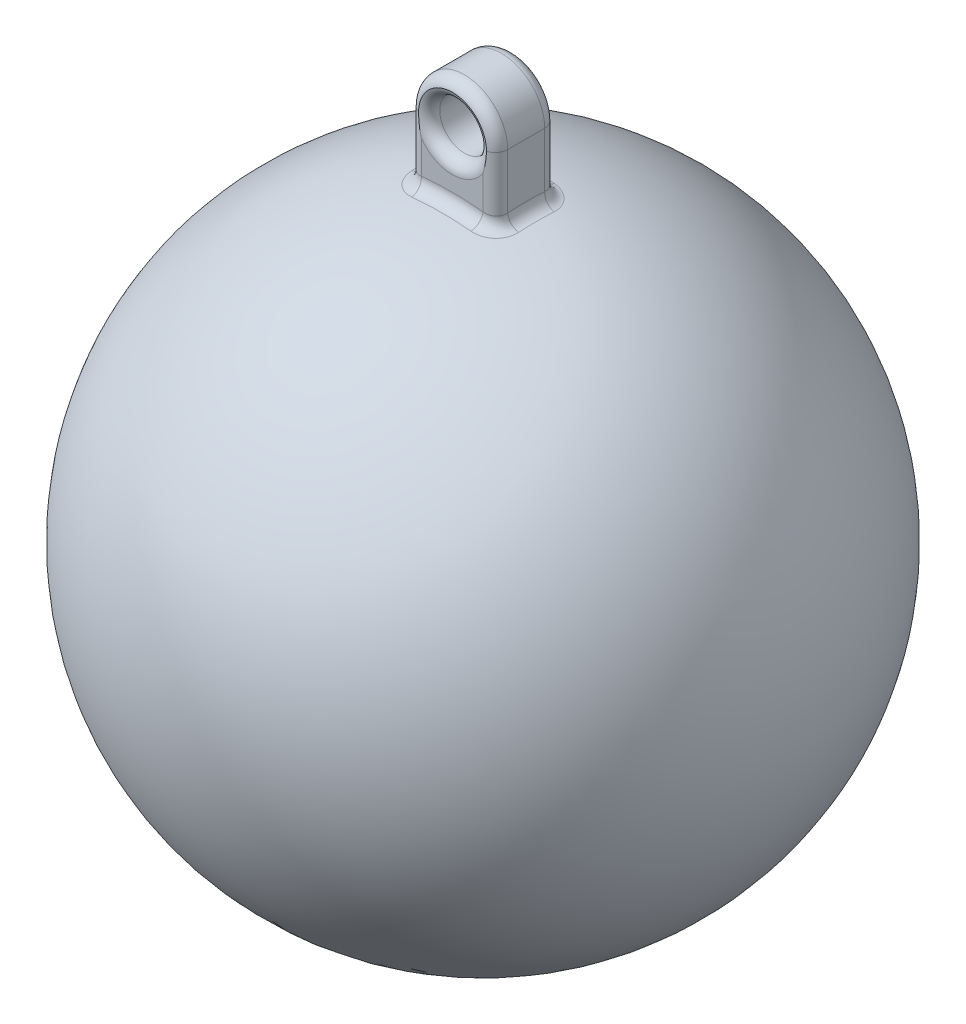
from build123d import *

# Parameters (mm, degrees)
SKETCH2_R           = 2
BOSS_EXTRUDE1_DEPTH = 2.5
FILLET1_R           = 1


with BuildPart() as part:
    # Sketch1 → Revolve1 (revolve)
    with BuildSketch(Plane(origin=(0, 0, 0), x_dir=(1, 0, 0), z_dir=(0, 1, 0))):
        with BuildLine():
            Line((-25, 0), (25, 0))
            ThreePointArc((25, 0), (0, 25), (-25, 0))
        make_face()
    revolve(axis=Axis((-25, 0, 0), (1, 0, 0)))

    # Sketch2 → Boss-Extrude1 (add, symmetric)
    with BuildSketch(Plane.XY):
        with BuildLine():
            Line((-3.5, 20), (3.5, 20))
            Line((3.5, 20), (3.5, 30))
            ThreePointArc((3.5, 30), (0, 33.5), (-3.5, 30))
            Line((-3.5, 30), (-3.5, 20))
        make_face()
        with Locations((0, 30)):
            Circle(SKETCH2_R, mode=Mode.SUBTRACT)
    extrude(amount=BOSS_EXTRUDE1_DEPTH, both=True)

    # Fillet1
    fillet1_edges = [part.edges().sort_by_distance(p)[0] for p in [
        (-3.5, 27.313610356, 2.5),
        (3.5, 27.313610356, 2.5),
        (0, 33.5, 2.5),
    ]]
    fillet(fillet1_edges, radius=FILLET1_R)
    fillet1_2_edges = [part.edges().sort_by_distance(p)[0] for p in [
        (-3.5, 27.313610356, -2.5),
        (0, 33.5, -2.5),
        (3.5, 27.313610356, -2.5),
    ]]
    fillet(fillet1_2_edges, radius=FILLET1_R)
    fillet1_3_edges = [part.edges().sort_by_distance(p)[0] for p in [
        (0, 24.874685928, -2.5),
    ]]
    fillet(fillet1_3_edges, radius=FILLET1_R)
    # the kernel refuses this fillet: 1 mm, written as the material it takes off along each edge
    with BuildSketch(Plane(origin=(0, 30, -2.5), x_dir=(1, 0, 0), z_dir=(0, -1, 0))) as fillet1_4_piece_1:
        with BuildLine():
            CenterArc((2 + FILLET1_R, FILLET1_R), FILLET1_R, 180, 90)
            Line((2, FILLET1_R), (2 - FILLET1_R * 0.02, FILLET1_R))
            Line((2 - FILLET1_R * 0.02, FILLET1_R), (2 - FILLET1_R * 0.02, -FILLET1_R * 0.02))
            Line((2 - FILLET1_R * 0.02, -FILLET1_R * 0.02), (2 + FILLET1_R, -FILLET1_R * 0.02))
            Line((2 + FILLET1_R, -FILLET1_R * 0.02), (2 + FILLET1_R, 0))
        make_face()
    revolve(axis=Axis((0, 30, -2.5), (0, 0, 1)), mode=Mode.SUBTRACT)
    # the kernel refuses this fillet: 1 mm, written as the material it takes off along each edge
    with BuildSketch(Plane(origin=(0, 30, 2.5), x_dir=(1, 0, 0), z_dir=(0, -1, 0))) as fillet1_5_piece_1:
        with BuildLine():
            CenterArc((2 + FILLET1_R, -FILLET1_R), FILLET1_R, 90, 90)
            Line((2, -FILLET1_R), (2 - FILLET1_R * 0.02, -FILLET1_R))
            Line((2 - FILLET1_R * 0.02, -FILLET1_R), (2 - FILLET1_R * 0.02, FILLET1_R * 0.02))
            Line((2 - FILLET1_R * 0.02, FILLET1_R * 0.02), (2 + FILLET1_R, FILLET1_R * 0.02))
            Line((2 + FILLET1_R, FILLET1_R * 0.02), (2 + FILLET1_R, 0))
        make_face()
    revolve(axis=Axis((0, 30, 2.5), (0, 0, 1)), mode=Mode.SUBTRACT)


solid = part.part
